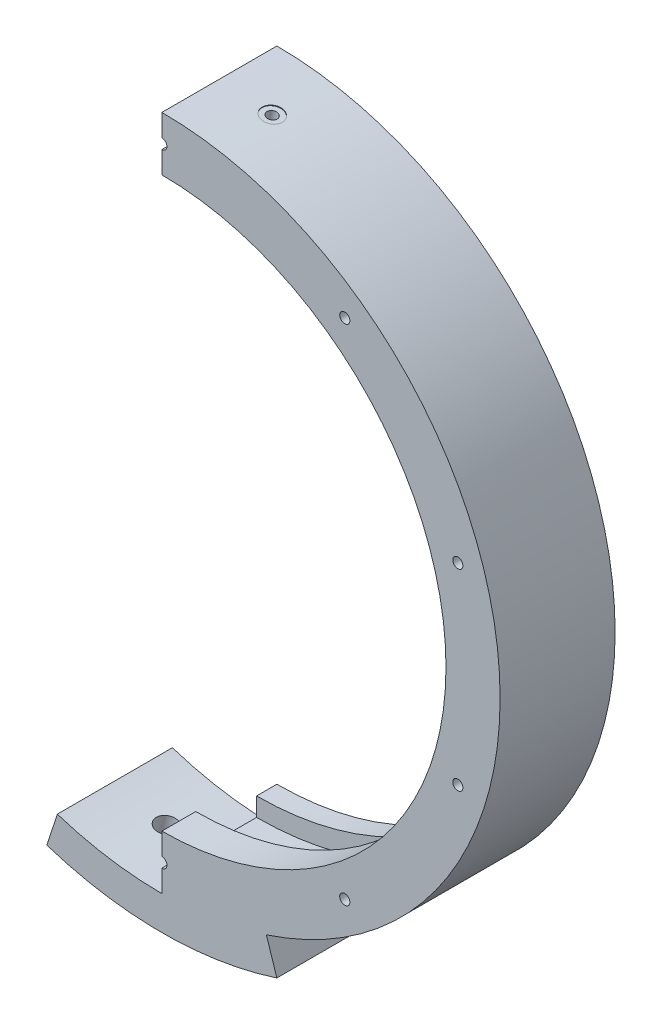
from build123d import *

# Parameters (mm, degrees)
SKETCH_1_R               = 49.25
SKETCH_1_R_2             = 44.5
EXTRUDE_1_DEPTH          = 17
CUT_EXTRUDE_START        = 17
SKETCH_1_5_R             = 47.25
CUT_EXTRUDE_2_DEPTH      = 14
EXTRUDE_START            = 12
SKETCH_1_6_R             = 49.25
SKETCH_1_6_R_2           = 42
EXTRUDE_2_DEPTH          = 5
SKETCH_2_R               = 50
SKETCH_2_R_2             = 49.25
EXTRUDE_3_DEPTH          = 17
SKETCH_2_4_R             = 0.75
CUT_EXTRUDE_3_DEPTH      = 4
PATTERN_CIRCULAR_1_COUNT = 10
EXTRUDE_START_2          = 8.5
EXTRUDE_4_DEPTH          = 17
PATTERN_CIRCULAR_2_COUNT = 2
CUT_EXTRUDE_START_2      = -8.5
CUT_EXTRUDE_5_DEPTH      = 17


# Read off the part's stored shape, not the designer's step: 切除-拉伸5
with BuildPart() as part:
    # 草图1 → 凸台-拉伸1 (new body)
    with BuildSketch(Plane.XY):
        Circle(SKETCH_1_R)
        Circle(SKETCH_1_R_2, mode=Mode.SUBTRACT)
    extrude(amount=EXTRUDE_1_DEPTH)

    # 草图1<5> → 切除-拉伸2 (cut)
    with BuildSketch(Plane.XY.offset(CUT_EXTRUDE_START)):
        Circle(SKETCH_1_5_R)
    extrude(amount=-CUT_EXTRUDE_2_DEPTH, mode=Mode.SUBTRACT)

    # 草图1<6> → 凸台-拉伸2 (add)
    with BuildSketch(Plane.XY.offset(EXTRUDE_START)):
        Circle(SKETCH_1_6_R)
        Circle(SKETCH_1_6_R_2, mode=Mode.SUBTRACT)
    extrude(amount=EXTRUDE_2_DEPTH)

    # 草图2 → 凸台-拉伸3 (add, through all)
    with BuildSketch(Plane.XY.offset(17)):
        Circle(SKETCH_2_R)
        Circle(SKETCH_2_R_2, mode=Mode.SUBTRACT)
    extrude(amount=-EXTRUDE_3_DEPTH)

    # 草图2<4> → 切除-拉伸3 (cut)
    with BuildSketch(Plane.XY.offset(17)):
        with Locations((0, 46)):
            Circle(SKETCH_2_4_R)
    cut_extrude_3 = extrude(amount=-CUT_EXTRUDE_3_DEPTH, mode=Mode.SUBTRACT)

    # 阵列(圆周)1: 切除-拉伸3 ×10 about axis
    pattern_circular_1_axis = Axis((0, 0, 0), (0, 0, 1))
    for i in range(1, PATTERN_CIRCULAR_1_COUNT):
        add(cut_extrude_3.rotate(pattern_circular_1_axis, i * 360 / PATTERN_CIRCULAR_1_COUNT), mode=Mode.SUBTRACT)

    # 草图3 → 凸台-拉伸4 (add)
    with BuildSketch(Plane.XY.offset(8.5).offset(EXTRUDE_START_2)):
        with BuildLine():
            Line((15.450849719, 47.552825815), (16.995934691, 52.308108396))
            ThreePointArc((16.995934691, 52.308108396), (0, 55), (-16.995934691, 52.308108396))
            Line((-16.995934691, 52.308108396), (-15.450849719, 47.552825815))
            ThreePointArc((-15.450849719, 47.552825815), (0, 50), (15.450849719, 47.552825815))
        make_face()
    extrude_4 = extrude(amount=-EXTRUDE_4_DEPTH)

    # 草图3<5> → 切除-旋转1 (revolve, cut)
    with BuildSketch(Plane.XY.offset(8.5)):
        Polygon((6.324547295, 49.520299893), (7.06531355, 49.402974044), (7.806079806, 49.285648196), (8.291026647, 52.347482052), (6.809494136, 52.582133749), align=None)
        Polygon((7.806079806, 49.285648196), (7.06531355, 49.402974044), (6.43957569, 45.452220682), (7.180341945, 45.334894833), align=None)
        Polygon((6.809494136, 52.582133749), (8.291026647, 52.347482052), (8.603895577, 54.322858733), (6.381596811, 54.674836279), (6.068727881, 52.699459598), align=None)
    cut_revolve_1 = revolve(axis=Axis((7.821723252, 49.38441703, 8.5), (-0.15643446504023117, -0.9876883405951378, 0)), mode=Mode.SUBTRACT)

    # 阵列(圆周)2: 凸台-拉伸4, 切除-旋转1 ×2 about axis
    pattern_circular_2_axis = Axis((0, 0, 0), (0, 0, 1))
    add([extrude_4.rotate(pattern_circular_2_axis, i * 360 / PATTERN_CIRCULAR_2_COUNT) for i in range(1, PATTERN_CIRCULAR_2_COUNT)])
    add([cut_revolve_1.rotate(pattern_circular_2_axis, i * 360 / PATTERN_CIRCULAR_2_COUNT) for i in range(1, PATTERN_CIRCULAR_2_COUNT)], mode=Mode.SUBTRACT)

    # 切除-拉伸5 outline → 切除-拉伸5 (cut)
    with BuildSketch(Plane.XY.offset(8.5).offset(CUT_EXTRUDE_START_2)):
        with BuildLine():
            ThreePointArc((0, 50), (7.821723252, 49.38441703), (15.450849719, 47.552825815))
            Line((15.450849719, 47.552825815), (16.995934691, 52.308108396))
            ThreePointArc((16.995934691, 52.308108396), (0, 55), (-16.995934691, 52.308108396))
            Line((-16.995934691, 52.308108396), (-15.450849719, 47.552825815))
            ThreePointArc((-15.450849719, 47.552825815), (-50, 0), (-15.450849719, -47.552825815))
            ThreePointArc((-15.450849719, -47.552825815), (-7.821723252, -49.38441703), (0, -50))
            Line((0, -50), (0, -42))
            ThreePointArc((0, -42), (-42, 0), (0, 42))
            Line((0, 42), (0, 50))
        make_face()
    extrude(amount=CUT_EXTRUDE_5_DEPTH, mode=Mode.SUBTRACT)


solid = part.part
